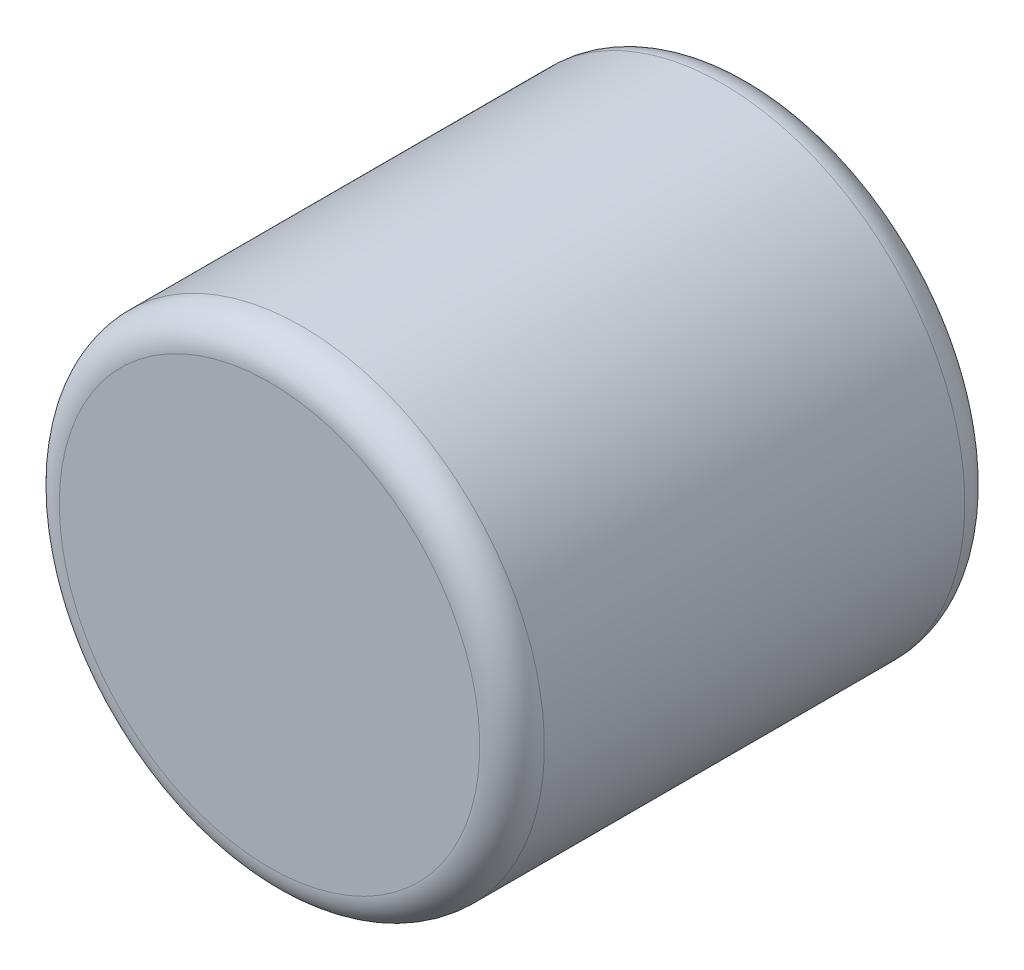
from build123d import *


with BuildPart() as part:
    # Эскиз2 → Повернуть1 (revolve)
    with BuildSketch(Plane(origin=(0, 0, 0), x_dir=(0, 0, -1), z_dir=(1, 0, 0))):
        with BuildLine():
            Line((0, 0), (-3, 0))
            Line((-3, 0), (-3, -1.3))
            ThreePointArc((-3, -1.3), (-2.941421356, -1.441421356), (-2.8, -1.5))
            Line((-2.8, -1.5), (-0.2, -1.5))
            ThreePointArc((-0.2, -1.5), (-0.058578644, -1.441421356), (0, -1.3))
            Line((0, -1.3), (0, 0))
        make_face()
    revolve(axis=Axis((0, 0, 0), (0, 0, 1)))


solid = part.part
